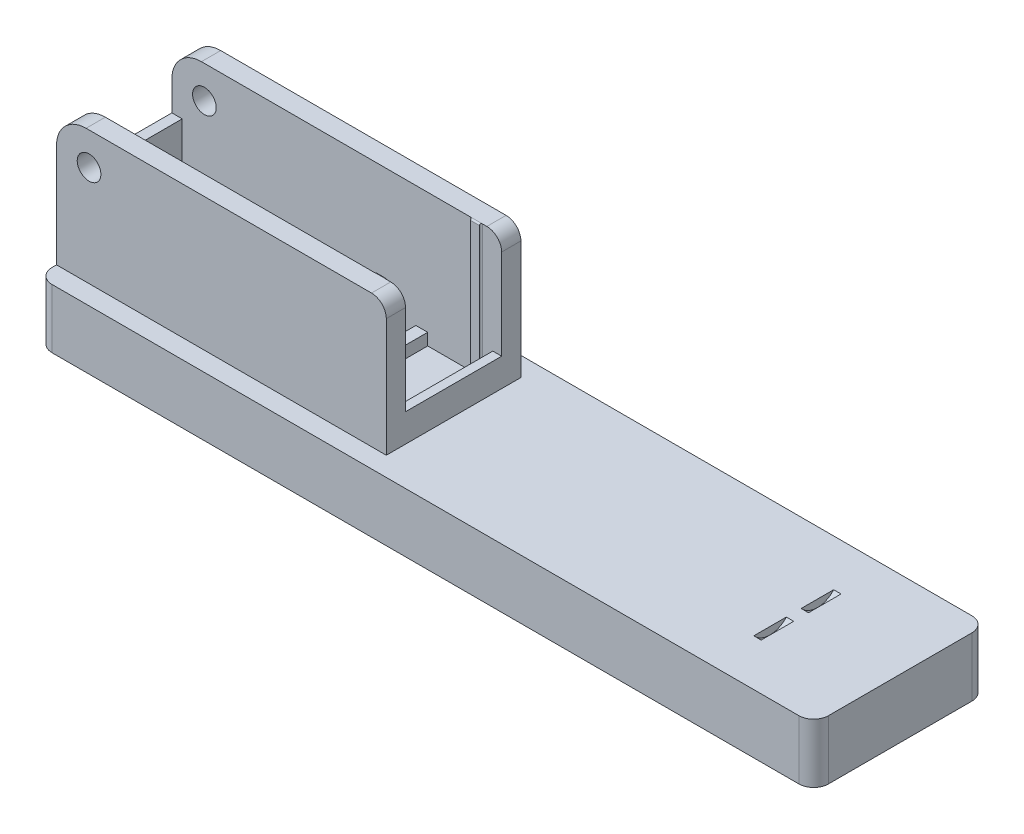
from build123d import *

# Parameters (mm, degrees)
BOSS_EXTRUDE1_DEPTH  = 10.16
SKETCH2_R            = 2.032
BOSS_EXTRUDE2_DEPTH  = 3.302
SKETCH3_W            = 1.778
SKETCH3_H            = 8.255
BOSS_EXTRUDE3_DEPTH  = 12.7
SKETCH4_W            = 1.524
SKETCH4_H            = 8.255
BOSS_EXTRUDE4_DEPTH  = 2.286
BOSS_EXTRUDE5_DEPTH  = 2.54
BOSS_EXTRUDE6_DEPTH  = 3.556
SKETCH7_W            = 2.032
SKETCH7_H            = 8.255
BOSS_EXTRUDE7_DEPTH  = 2.032
SKETCH8_W            = 1.524
SKETCH8_H            = 8.255
BOSS_EXTRUDE8_DEPTH  = 4.826
SKETCH9_W            = 1.524
SKETCH9_H            = 22.86
BOSS_EXTRUDE9_DEPTH  = 0.254
FILLET2_R            = 0.254
FILLET4_R            = 0.254
FILLET2_OF_MIRROR1_R = 0.254
FILLET4_OF_MIRROR1_R = 0.254
SKETCH10_R           = 3.7084
CUT_EXTRUDE1_DEPTH   = 1.27


with BuildPart() as part:
    # Sketch1 → Boss-Extrude1 (new body)
    with BuildSketch(Plane(origin=(0, 0, 0), x_dir=(1, 0, 0), z_dir=(0, 1, 0))):
        with BuildLine():
            Line((-64.135, 14.859), (64.135, 14.859))
            ThreePointArc((64.135, 14.859), (65.931051224, 14.115051224), (66.675, 12.319))
            Line((66.675, 12.319), (66.675, -12.319))
            ThreePointArc((66.675, -12.319), (65.931051224, -14.115051224), (64.135, -14.859))
            Line((64.135, -14.859), (-64.135, -14.859))
            ThreePointArc((-64.135, -14.859), (-65.931051224, -14.115051224), (-66.675, -12.319))
            Line((-66.675, -12.319), (-66.675, 12.319))
            ThreePointArc((-66.675, 12.319), (-65.931051224, 14.115051224), (-64.135, 14.859))
        make_face()
    extrude(amount=BOSS_EXTRUDE1_DEPTH)

    # Sketch2 → Boss-Extrude2 (add)
    with BuildSketch(Plane.XY.offset(11.557)):
        with BuildLine():
            Line((-10.033, 10.16), (-10.033, 30.48))
            ThreePointArc((-10.033, 30.48), (-10.776948776, 32.276051224), (-12.573, 33.02))
            Line((-12.573, 33.02), (-61.595, 33.02))
            ThreePointArc((-61.595, 33.02), (-65.187102448, 31.532102448), (-66.675, 27.94))
            Line((-66.675, 27.94), (-66.675, 10.16))
            Line((-66.675, 10.16), (-10.033, 10.16))
        make_face()
        with Locations((-61.087, 27.432)):
            Circle(SKETCH2_R, mode=Mode.SUBTRACT)
    boss_extrude2 = extrude(amount=-BOSS_EXTRUDE2_DEPTH)

    # Sketch3 → Boss-Extrude3 (add)
    with BuildSketch(Plane(origin=(0, 10.16, 0), x_dir=(1, 0, 0), z_dir=(0, 1, 0))):
        with Locations((-65.786, -4.1275)):
            Rectangle(SKETCH3_W, SKETCH3_H)
    boss_extrude3 = extrude(amount=BOSS_EXTRUDE3_DEPTH)

    # Sketch4 → Boss-Extrude4 (add)
    with BuildSketch(Plane(origin=(0, 10.16, 0), x_dir=(1, 0, 0), z_dir=(0, 1, 0))):
        with Locations((-53.975, -4.1275)):
            Rectangle(SKETCH4_W, SKETCH4_H)
    boss_extrude4 = extrude(amount=BOSS_EXTRUDE4_DEPTH)

    # Sketch5 → Boss-Extrude5 (add)
    with BuildSketch(Plane(origin=(0, 10.16, 0), x_dir=(1, 0, 0), z_dir=(0, 1, 0))):
        with BuildLine():
            Line((-48.133, 0), (-49.911, 0))
            ThreePointArc((-49.911, 0), (-45.593, -4.318), (-41.275, 0))
            Line((-41.275, 0), (-43.053, 0))
            ThreePointArc((-43.053, 0), (-45.593, -2.54), (-48.133, 0))
        make_face()
    boss_extrude5 = extrude(amount=BOSS_EXTRUDE5_DEPTH)

    # Sketch6 → Boss-Extrude6 (add)
    with BuildSketch(Plane(origin=(0, 10.16, 0), x_dir=(1, 0, 0), z_dir=(0, 1, 0))):
        with BuildLine():
            Line((-33.909, -1.813922821), (-33.909, -3.654423621))
            ThreePointArc((-33.909, -3.654423621), (-35.576423631, -2.155261469), (-36.195, 0))
            Line((-36.195, 0), (-34.671, 0))
            ThreePointArc((-34.671, 0), (-34.472764292, -0.98373777), (-33.909, -1.813922821))
        make_face()
        with BuildLine():
            Line((-30.353, -1.813922821), (-30.353, -3.654423621))
            ThreePointArc((-30.353, -3.654423621), (-28.685576369, -2.155261469), (-28.067, 0))
            Line((-28.067, 0), (-29.591, 0))
            ThreePointArc((-29.591, 0), (-29.789235708, -0.98373777), (-30.353, -1.813922821))
        make_face()
    boss_extrude6 = extrude(amount=BOSS_EXTRUDE6_DEPTH)

    # Sketch7 → Boss-Extrude7 (add)
    with BuildSketch(Plane(origin=(0, 10.16, 0), x_dir=(1, 0, 0), z_dir=(0, 1, 0))):
        with Locations((-23.749, -4.1275)):
            Rectangle(SKETCH7_W, SKETCH7_H)
    boss_extrude7 = extrude(amount=BOSS_EXTRUDE7_DEPTH)

    # Sketch8 → Boss-Extrude8 (add)
    with BuildSketch(Plane(origin=(0, 10.16, 0), x_dir=(1, 0, 0), z_dir=(0, 1, 0))):
        with Locations((-10.795, -4.1275)):
            Rectangle(SKETCH8_W, SKETCH8_H)
    boss_extrude8 = extrude(amount=BOSS_EXTRUDE8_DEPTH)

    # Sketch9 → Boss-Extrude9 (add)
    with BuildSketch(Plane(origin=(0, 0, 8.255), x_dir=(-1, 0, 0), z_dir=(0, 0, -1))):
        with Locations((14.351, 21.59)):
            Rectangle(SKETCH9_W, SKETCH9_H)
    boss_extrude9 = extrude(amount=BOSS_EXTRUDE9_DEPTH)

    # Fillet2
    fillet2_edges = [part.edges().sort_by_distance(p)[0] for p in [
        (-13.589, 21.59, 8.255),
        (-15.113, 21.59, 8.255),
    ]]
    fillet(fillet2_edges, radius=FILLET2_R - 0.0001)  # a hair under: the kernel refuses the full size

    # Fillet4
    fillet4_edges = [part.edges().sort_by_distance(p)[0] for p in [
        (-14.351, 33.02, 8.001),
    ]]
    fillet(fillet4_edges, radius=FILLET4_R - 0.0001)  # a hair under: the kernel refuses the full size

    # Mirror1: Boss-Extrude2, Boss-Extrude3, Boss-Extrude4, Boss-Extrude5, Boss-Extrude6, Boss-Extrude7, Boss-Extrude8, Boss-Extrude9 across plane
    add(boss_extrude2.mirror(Plane.XY))
    add(boss_extrude3.mirror(Plane.XY))
    add(boss_extrude4.mirror(Plane.XY))
    add(boss_extrude5.mirror(Plane.XY))
    add(boss_extrude6.mirror(Plane.XY))
    add(boss_extrude7.mirror(Plane.XY))
    add(boss_extrude8.mirror(Plane.XY))
    add(boss_extrude9.mirror(Plane.XY))

    # Fillet2 of Mirror1
    fillet2_of_mirror1_edges = [part.edges().sort_by_distance(p)[0] for p in [
        (-13.589, 21.59, -8.255),
        (-15.113, 21.59, -8.255),
    ]]
    fillet(fillet2_of_mirror1_edges, radius=FILLET2_OF_MIRROR1_R - 0.0001)  # a hair under: the kernel refuses the full size

    # Fillet4 of Mirror1
    fillet4_of_mirror1_edges = [part.edges().sort_by_distance(p)[0] for p in [
        (-14.351, 33.02, -8.001),
    ]]
    fillet(fillet4_of_mirror1_edges, radius=FILLET4_OF_MIRROR1_R - 0.0001)  # a hair under: the kernel refuses the full size

    # Sketch10 → Cut-Extrude1 (cut)
    with BuildSketch(Plane(origin=(49.657, 0, 0), x_dir=(0, 0, -1), z_dir=(1, 0, 0))):
        with Locations((-4.064, 12.5984)):
            Circle(SKETCH10_R)
    cut_extrude1 = extrude(amount=-CUT_EXTRUDE1_DEPTH, mode=Mode.SUBTRACT)

    # Mirror2: Cut-Extrude1 across plane
    add(cut_extrude1.mirror(Plane.XY), mode=Mode.SUBTRACT)


solid = part.part
